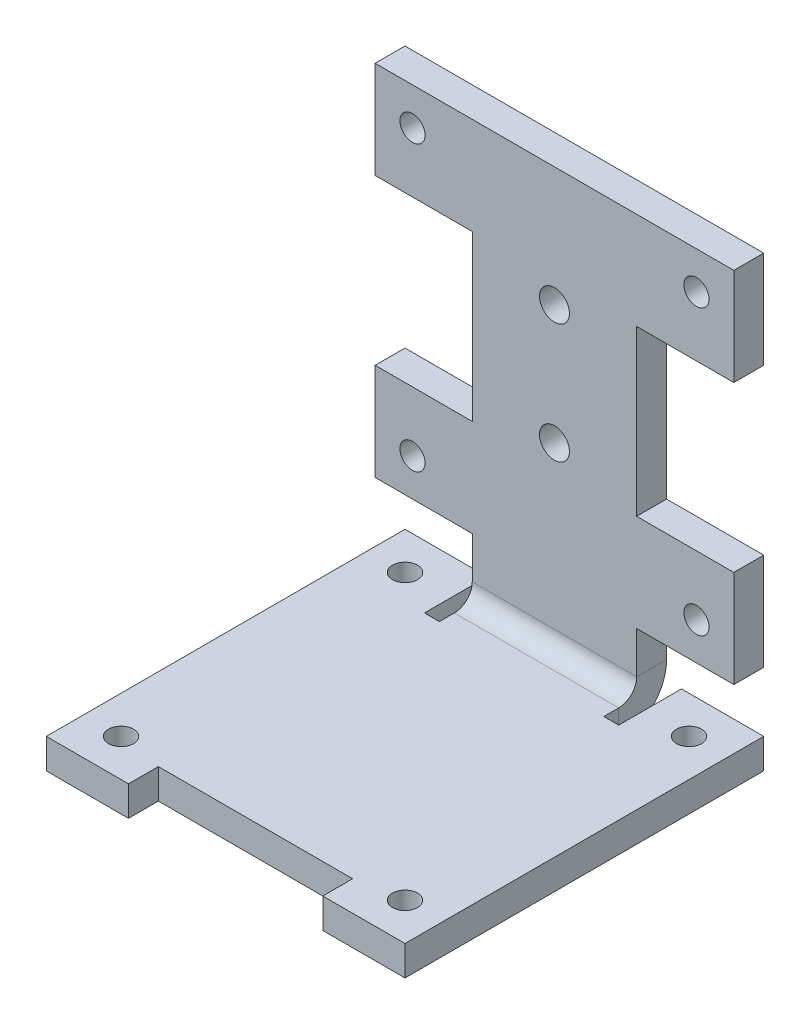
from build123d import *

# Parameters (mm, degrees)
SKETCH_1_R                        = 2.1
SM_BASE_FLANGE_1_DEPTH            = 5
SM_EDGE_FLANGE_1_STRIP_W          = 26
SM_EDGE_FLANGE_1_STRIP_H          = 5
SM_EDGE_FLANGE_1_STRIP_CUT_DEPTH  = 27.5
SM_EDGE_FLANGE_1_RELIEF_W         = 28.5
SM_EDGE_FLANGE_1_RELIEF_H         = 2.5
SM_EDGE_FLANGE_1_RELIEF_CUT_DEPTH = 5
SM_EDGE_FLANGE_1_DEPTH            = 27.5
EXTRUDE_START                     = -30
SKETCH_9_W                        = 16.25
SKETCH_9_H                        = 16.25
EXTRUDE_1_DEPTH                   = 5
CUT_EXTRUDE_START                 = -30
SKETCH_10_R                       = 2.5
CUT_EXTRUDE_1_DEPTH               = 5
SKETCH_11_R                       = 2.1
CUT_EXTRUDE_2_DEPTH               = 5


# Sheet-metal steps are written as plain solids
with BuildPart() as part:
    # Sketch 1 → 基体-法兰1 (new body)
    with BuildSketch(Plane(origin=(0, 0, 0), x_dir=(1, 0, 0), z_dir=(0, 1, 0))):
        Polygon((-16.25, 25), (-16.25, 30), (-30, 30), (-30, -30), (-16.25, -30), (-16.25, -25), (16.25, -25), (16.25, -30), (30, -30), (30, 30), (16.25, 30), (16.25, 25), align=None)
        with Locations(Location((-23.75, 23.75, 0), (0, 0, 270))):
            Circle(SKETCH_1_R, mode=Mode.SUBTRACT)
        with Locations(Location((23.75, 23.75, 0), (0, 0, 270))):
            Circle(SKETCH_1_R, mode=Mode.SUBTRACT)
        with Locations(Location((-23.75, -23.75, 0), (0, 0, 270))):
            Circle(SKETCH_1_R, mode=Mode.SUBTRACT)
        with Locations(Location((23.75, -23.75, 0), (0, 0, 270))):
            Circle(SKETCH_1_R, mode=Mode.SUBTRACT)
    extrude(amount=-SM_BASE_FLANGE_1_DEPTH)

    # 边线-法兰1 strip (across the edge) → 边线-法兰1 strip cut (cut)
    with BuildSketch(Plane(origin=(13.75, 0, -25), x_dir=(0, 0, 1), z_dir=(-1, 0, 0))):
        with Locations((-10, -2.5)):
            Rectangle(SM_EDGE_FLANGE_1_STRIP_W, SM_EDGE_FLANGE_1_STRIP_H)
    extrude(amount=SM_EDGE_FLANGE_1_STRIP_CUT_DEPTH, mode=Mode.SUBTRACT)

    # 边线-法兰1 relief (on the sheet) → 边线-法兰1 relief cut (cut)
    with BuildSketch(Plane(origin=(13.75, 0, -22), x_dir=(0, 0, 1), z_dir=(0, 1, 0))):
        with Locations((-11.75, 1.25)):
            Rectangle(SM_EDGE_FLANGE_1_RELIEF_W, SM_EDGE_FLANGE_1_RELIEF_H)
        with Locations((-11.75, -28.75)):
            Rectangle(SM_EDGE_FLANGE_1_RELIEF_W, SM_EDGE_FLANGE_1_RELIEF_H)
    extrude(amount=-SM_EDGE_FLANGE_1_RELIEF_CUT_DEPTH, mode=Mode.SUBTRACT)

    # 边线-法兰1 section (across the edge) → 边线-法兰1 (add)
    with BuildSketch(Plane(origin=(13.75, 0, -25), x_dir=(0, 0, 1), z_dir=(-1, 0, 0))):
        with BuildLine():
            Line((-5, 3), (-5, 70))
            Line((-5, 70), (0, 70))
            Line((0, 70), (0, 3))
            ThreePointArc((0, 3), (0.878679656, 0.878679656), (3, 0))
            Line((3, 0), (3, -5))
            ThreePointArc((3, -5), (-2.656854249, -2.656854249), (-5, 3))
        make_face()
    extrude(amount=SM_EDGE_FLANGE_1_DEPTH)

    # 草图9 → 凸台-拉伸1 (add)
    with BuildSketch(Plane.XY.offset(EXTRUDE_START)):
        with Locations((-21.875, 61.875)):
            Rectangle(SKETCH_9_W, SKETCH_9_H)
        with Locations((21.875, 61.875)):
            Rectangle(SKETCH_9_W, SKETCH_9_H)
        with Locations((-21.875, 18.125)):
            Rectangle(SKETCH_9_W, SKETCH_9_H)
        with Locations((21.875, 18.125)):
            Rectangle(SKETCH_9_W, SKETCH_9_H)
    extrude(amount=EXTRUDE_1_DEPTH)

    # 草图10 → 切除-拉伸1 (cut)
    with BuildSketch(Plane.XY.offset(CUT_EXTRUDE_START)):
        with Locations(Location((0, 50, 0), (0, 0, 90))):
            Circle(SKETCH_10_R)
        with Locations(Location((0, 30, 0), (0, 0, 90))):
            Circle(SKETCH_10_R)
    extrude(amount=CUT_EXTRUDE_1_DEPTH, mode=Mode.SUBTRACT)

    # 草图11 → 切除-拉伸2 (cut)
    with BuildSketch(Plane.XY.offset(CUT_EXTRUDE_START)):
        with Locations((-23.75, 16.25)):
            Circle(SKETCH_11_R)
        with Locations((-23.75, 63.75)):
            Circle(SKETCH_11_R)
        with Locations((23.75, 63.75)):
            Circle(SKETCH_11_R)
        with Locations((23.75, 16.25)):
            Circle(SKETCH_11_R)
    extrude(amount=CUT_EXTRUDE_2_DEPTH, mode=Mode.SUBTRACT)


solid = part.part
